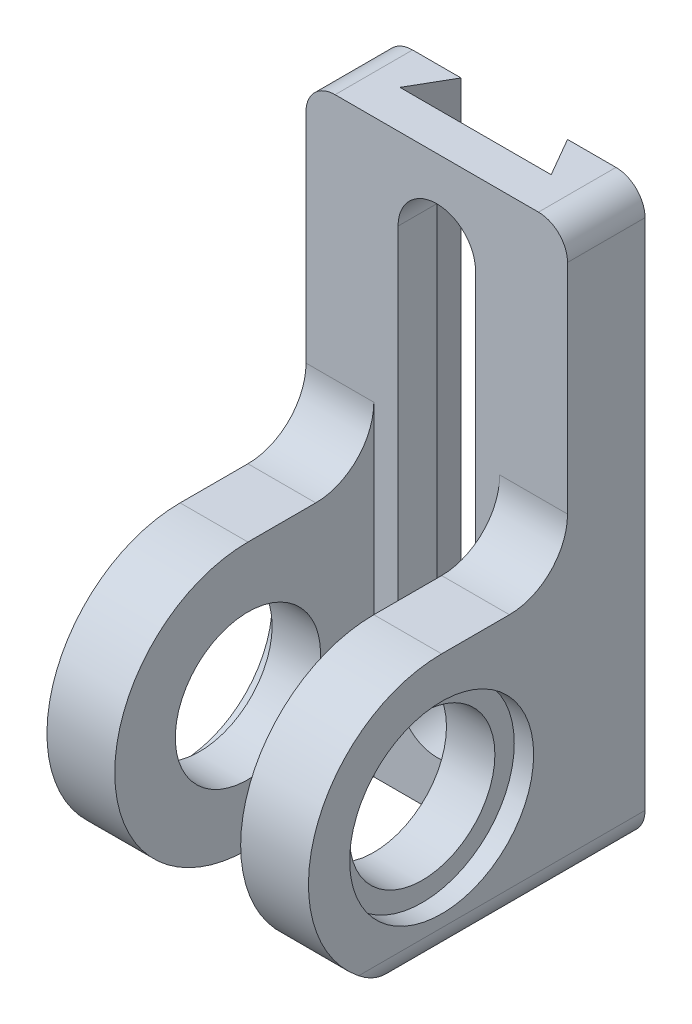
from build123d import *

# Parameters (mm, degrees)
BOSS_EXTRUDE1_DEPTH                     = 27
CBORE_FOR_M5_HEX_HEAD_BOLT1_D           = 30
CBORE_FOR_M5_HEX_HEAD_BOLT1_CBORE_D     = 38
CBORE_FOR_M5_HEX_HEAD_BOLT1_CBORE_DEPTH = 4
SKETCH5_W                               = 13
SKETCH5_H                               = 53.5
CUT_EXTRUDE2_DEPTH                      = 140.582412932
CUT_EXTRUDE3_DEPTH                      = 140.582412932
CUT_EXTRUDE3_DEPTH_BACK                 = 140.582412932
CUT_EXTRUDE4_DEPTH                      = 141.36470354
FILLET1_R                               = 6
FILLET2_R                               = 6


with BuildPart() as part:
    # Sketch1 → Boss-Extrude1 (new body)
    with BuildSketch(Plane.YZ):
        with BuildLine():
            Line((0, 0), (0, 42))
            ThreePointArc((0, 42), (27.5, 69.5), (55, 42))
            Line((55, 42), (55, 28))
            ThreePointArc((55, 28), (58.514718626, 19.514718626), (67, 16))
            Line((67, 16), (118, 16))
            Line((118, 16), (118, 0))
            Line((118, 0), (0, 0))
        make_face()
    extrude(amount=-BOSS_EXTRUDE1_DEPTH)

    # CBORE for M5 Hex Head Bolt1 (through all)
    with Locations(Plane.YZ):
        with Locations((27.5, 42)):
            CounterBoreHole(CBORE_FOR_M5_HEX_HEAD_BOLT1_D / 2, CBORE_FOR_M5_HEX_HEAD_BOLT1_CBORE_D / 2, CBORE_FOR_M5_HEX_HEAD_BOLT1_CBORE_DEPTH)

    # Sketch5 → Cut-Extrude2 (cut, through all)
    with BuildSketch(Plane.XZ):
        with Locations((-20.5, 42.75)):
            Rectangle(SKETCH5_W, SKETCH5_H)
    extrude(amount=-CUT_EXTRUDE2_DEPTH, mode=Mode.SUBTRACT)

    # Sketch6 → Cut-Extrude3 (cut, two sides: drawn at the far end of the back side and taken through both)
    with BuildSketch(Plane.XZ.offset(-CUT_EXTRUDE3_DEPTH_BACK)):
        Polygon((-92.317950055, -132.186567024), (-16, 0), (-11.381197846, 8), (-27, 8), (-179.635900109, 8), (-438.753666214, -153.396577713), (-351.43571616, -293.583144737), align=None)
    extrude(amount=CUT_EXTRUDE3_DEPTH + CUT_EXTRUDE3_DEPTH_BACK, mode=Mode.SUBTRACT)

    # Mirror1: part across plane


with BuildPart() as part_1:
    add(part.part)
    add(part.part.mirror(Plane(origin=(-27, 27.5, 42), x_dir=(0, 0, 1), z_dir=(-1, 0, 0))))

    # Sketch7 → Cut-Extrude4 (cut, through all)
    with BuildSketch(Plane.XY.offset(16)):
        with BuildLine():
            Line((-19, 101), (-19, 18))
            ThreePointArc((-19, 18), (-27, 10), (-35, 18))
            Line((-35, 18), (-35, 101))
            ThreePointArc((-35, 101), (-27, 109), (-19, 101))
        make_face()
    extrude(amount=-CUT_EXTRUDE4_DEPTH, mode=Mode.SUBTRACT)

    # Fillet1
    # the kernel refuses this fillet: 6 mm, written as the material it takes off along each edge
    with BuildSketch(Plane(origin=(0, 0, -36), x_dir=(0, 1, 0), z_dir=(0, 0, 1))) as fillet1_piece_1:
        with BuildLine():
            CenterArc((FILLET1_R, FILLET1_R), FILLET1_R, 180, 90)
            Line((0, FILLET1_R), (-FILLET1_R * 0.02, FILLET1_R))
            Line((-FILLET1_R * 0.02, FILLET1_R), (-FILLET1_R * 0.02, -FILLET1_R * 0.02))
            Line((-FILLET1_R * 0.02, -FILLET1_R * 0.02), (FILLET1_R, -FILLET1_R * 0.02))
            Line((FILLET1_R, -FILLET1_R * 0.02), (FILLET1_R, 0))
        make_face()
    extrude(amount=114, mode=Mode.SUBTRACT)

    # Fillet2
    # the kernel refuses this fillet: 6 mm, written as the material it takes off along each edge
    with BuildSketch(Plane(origin=(-54, 0, -36), x_dir=(0, 1, 0), z_dir=(0, 0, 1))) as fillet2_piece_1:
        with BuildLine():
            CenterArc((FILLET2_R, -FILLET2_R), FILLET2_R, 90, 90)
            Line((0, -FILLET2_R), (-FILLET2_R * 0.02, -FILLET2_R))
            Line((-FILLET2_R * 0.02, -FILLET2_R), (-FILLET2_R * 0.02, FILLET2_R * 0.02))
            Line((-FILLET2_R * 0.02, FILLET2_R * 0.02), (FILLET2_R, FILLET2_R * 0.02))
            Line((FILLET2_R, FILLET2_R * 0.02), (FILLET2_R, 0))
        make_face()
    extrude(amount=114, mode=Mode.SUBTRACT)
    with BuildSketch(Plane(origin=(-54, 118, 52), x_dir=(1, 0, 0), z_dir=(0, 0, -1)), Plane(origin=(0, 118, 52), x_dir=(0, -1, 0), z_dir=(0, 0, -1))) as fillet2_piece_2:
        with BuildLine():
            CenterArc((FILLET2_R, FILLET2_R), FILLET2_R, 180, 90)
            Line((0, FILLET2_R), (-FILLET2_R * 0.02, FILLET2_R))
            Line((-FILLET2_R * 0.02, FILLET2_R), (-FILLET2_R * 0.02, -FILLET2_R * 0.02))
            Line((-FILLET2_R * 0.02, -FILLET2_R * 0.02), (FILLET2_R, -FILLET2_R * 0.02))
            Line((FILLET2_R, -FILLET2_R * 0.02), (FILLET2_R, 0))
        make_face()
    extrude(amount=88, mode=Mode.SUBTRACT)


solid = part_1.part
